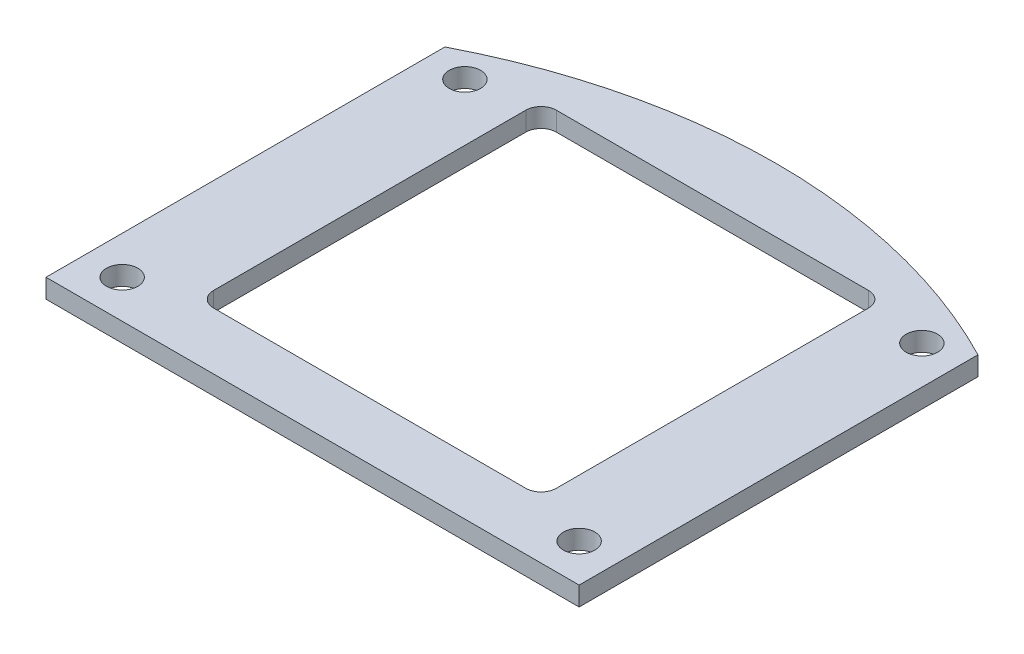
from build123d import *

# Parameters (mm, degrees)
SKETCH1_R           = 1.65
BOSS_EXTRUDE1_DEPTH = 2
FILLET1_R           = 1.6


with BuildPart() as part:
    # Sketch1 → Boss-Extrude1 (new body)
    with BuildSketch(Plane(origin=(0, 0, 0), x_dir=(1, 0, 0), z_dir=(0, 1, 0))):
        with BuildLine():
            Line((-28, 17.89570392), (-28, -24))
            Line((-28, -24), (28, -24))
            Line((28, -24), (28, 17.89570392))
            ThreePointArc((28, 17.89570392), (0, 24.701428863), (-28, 17.89570392))
        make_face()
        with Locations((-24, -20)):
            Circle(SKETCH1_R, mode=Mode.SUBTRACT)
        with Locations((24, -20)):
            Circle(SKETCH1_R, mode=Mode.SUBTRACT)
        Polygon((18, -18), (-18, -18), (-18, 17.989273523), (-18, 18), (-17.967615858, 18), (18, 18), align=None, mode=Mode.SUBTRACT)
        with Locations((-24, 16)):
            Circle(SKETCH1_R, mode=Mode.SUBTRACT)
        with Locations((24, 16)):
            Circle(SKETCH1_R, mode=Mode.SUBTRACT)
    extrude(amount=BOSS_EXTRUDE1_DEPTH)

    # Fillet1
    fillet1_edges = [part.edges().sort_by_distance(p)[0] for p in [
        (-18, 1, 18),
        (18, 1, 18),
        (18, 1, -18),
        (-18, 1, -18),
    ]]
    fillet(fillet1_edges, radius=FILLET1_R)


solid = part.part
